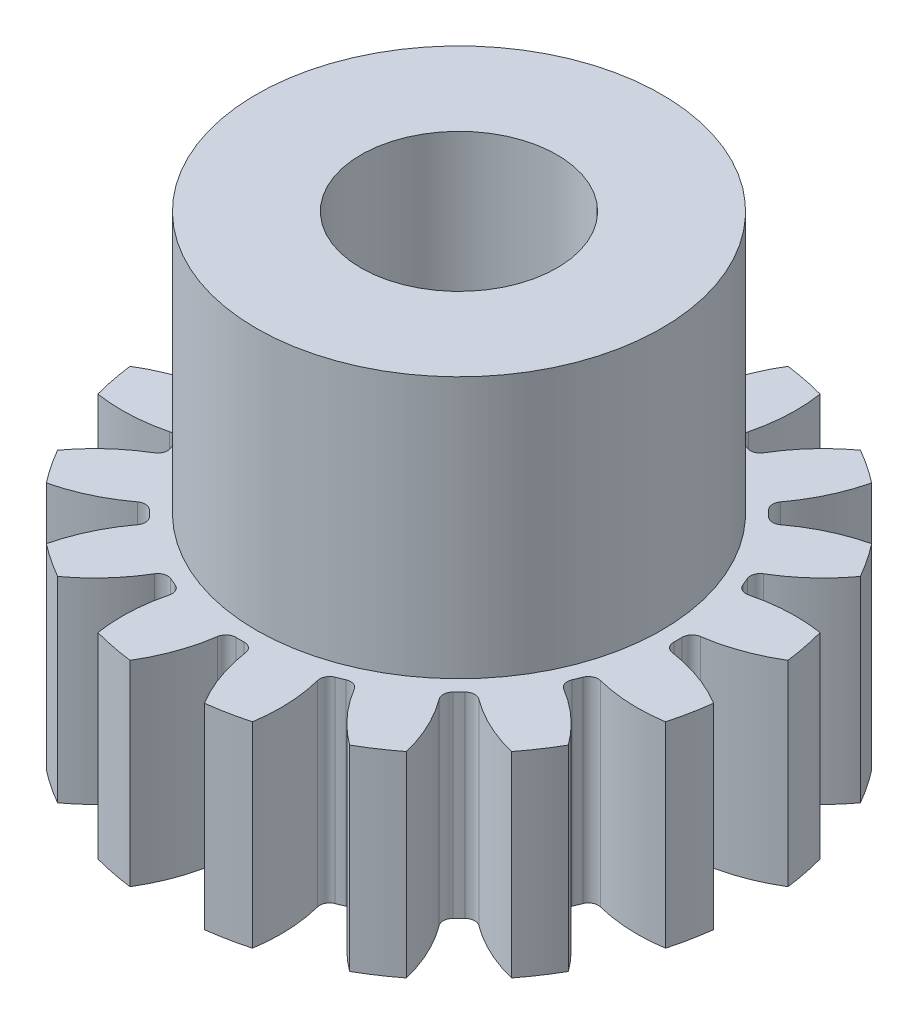
from build123d import *

# Parameters (mm, degrees)
SKETCH1_R                = 4.5
BOSS_EXTRUDE1_DEPTH      = 1.5
CUT_EXTRUDE1_DEPTH       = 7.538348415
FILLET2_R                = 0.15
CIRPATTERN1_COUNT        = 16
FILLET2_OF_CIRPATTERN1_R = 0.15
CUT_EXTRUDE2_DEPTH       = 7.488652665
CUT_EXTRUDE2_DEPTH_BACK  = 7.488652665
SKETCH4_R                = 1.5
SKETCH5_R                = 3.1
SKETCH5_R_2              = 1.5
BOSS_EXTRUDE2_DEPTH      = 4


with BuildPart() as part:
    # Sketch1 → Boss-Extrude1 (new, symmetric)
    with BuildSketch(Plane(origin=(0, 0, 0), x_dir=(1, 0, 0), z_dir=(0, 1, 0))):
        Circle(SKETCH1_R)
    extrude(amount=BOSS_EXTRUDE1_DEPTH, both=True)

    # Sketch3 → Cut-Extrude1 (cut, symmetric)
    with BuildSketch(Plane(origin=(0, 0, 0), x_dir=(1, 0, 0), z_dir=(0, 1, 0))):
        with BuildLine():
            ThreePointArc((1.679863237, 5.467765495), (0, 5.72), (-1.679863237, 5.467765495))
            ThreePointArc((-1.679863237, 5.467765495), (-0.658701663, 4.601539237), (-0.198221544, 3.344130413))
            ThreePointArc((-0.198221544, 3.344130413), (0, 3.35), (0.198221544, 3.344130413))
            ThreePointArc((0.198221544, 3.344130413), (0.658701663, 4.601539237), (1.679863237, 5.467765495))
        make_face()
    cut_extrude1 = extrude(amount=CUT_EXTRUDE1_DEPTH, both=True, mode=Mode.SUBTRACT)

    # Fillet2
    fillet2_edges = [part.edges().sort_by_distance(p)[0] for p in [
        (0.198221544, 0, -3.344130413),
        (-0.198221544, 0, -3.344130413),
    ]]
    fillet(fillet2_edges, radius=FILLET2_R)

    # CirPattern1: Cut-Extrude1 ×16 about axis
    cirpattern1_axis = Axis((0, -1.5, 0), (0, 1, 0))
    for i in range(1, CIRPATTERN1_COUNT):
        add(cut_extrude1.rotate(cirpattern1_axis, i * 360 / CIRPATTERN1_COUNT), mode=Mode.SUBTRACT)

    # Fillet2 of CirPattern1
    fillet2_of_cirpattern1_edges = [part.edges().sort_by_distance(p)[0] for p in [
        (-1.096610478, 0, -3.165429743),
        (-1.462876132, 0, -3.013717542),
        (-2.224493494, 0, -2.50482109),
        (-2.50482109, 0, -2.224493494),
        (-3.013717542, 0, -1.462876132),
        (-3.165429743, 0, -1.096610478),
        (-3.344130413, 0, -0.198221544),
        (-3.344130413, 0, 0.198221544),
        (-3.165429743, 0, 1.096610478),
        (-3.013717542, 0, 1.462876132),
        (-2.50482109, 0, 2.224493494),
        (-2.224493494, 0, 2.50482109),
        (-1.462876132, 0, 3.013717542),
        (-1.096610478, 0, 3.165429743),
        (-0.198221544, 0, 3.344130413),
        (0.198221544, 0, 3.344130413),
        (1.096610478, 0, 3.165429743),
        (1.462876132, 0, 3.013717542),
        (2.224493494, 0, 2.50482109),
        (2.50482109, 0, 2.224493494),
        (3.013717542, 0, 1.462876132),
        (3.165429743, 0, 1.096610478),
        (3.344130413, 0, 0.198221544),
        (3.344130413, 0, -0.198221544),
        (3.165429743, 0, -1.096610478),
        (3.013717542, 0, -1.462876132),
        (2.50482109, 0, -2.224493494),
        (2.224493494, 0, -2.50482109),
        (1.462876132, 0, -3.013717542),
        (1.096610478, 0, -3.165429743),
    ]]
    fillet(fillet2_of_cirpattern1_edges, radius=FILLET2_OF_CIRPATTERN1_R)

    # Sketch4 → Cut-Extrude2 (cut, two sides: drawn at the far end of the back side and taken through both)
    with BuildSketch(Plane(origin=(0, 0, 0), x_dir=(1, 0, 0), z_dir=(0, 1, 0)).offset(-CUT_EXTRUDE2_DEPTH_BACK)):
        Circle(SKETCH4_R)
    extrude(amount=CUT_EXTRUDE2_DEPTH + CUT_EXTRUDE2_DEPTH_BACK, mode=Mode.SUBTRACT)

    # Sketch5 → Boss-Extrude2 (add)
    with BuildSketch(Plane(origin=(0, 1.5, 0), x_dir=(1, 0, 0), z_dir=(0, 1, 0))):
        Circle(SKETCH5_R)
        Circle(SKETCH5_R_2, mode=Mode.SUBTRACT)
    extrude(amount=BOSS_EXTRUDE2_DEPTH)


solid = part.part
